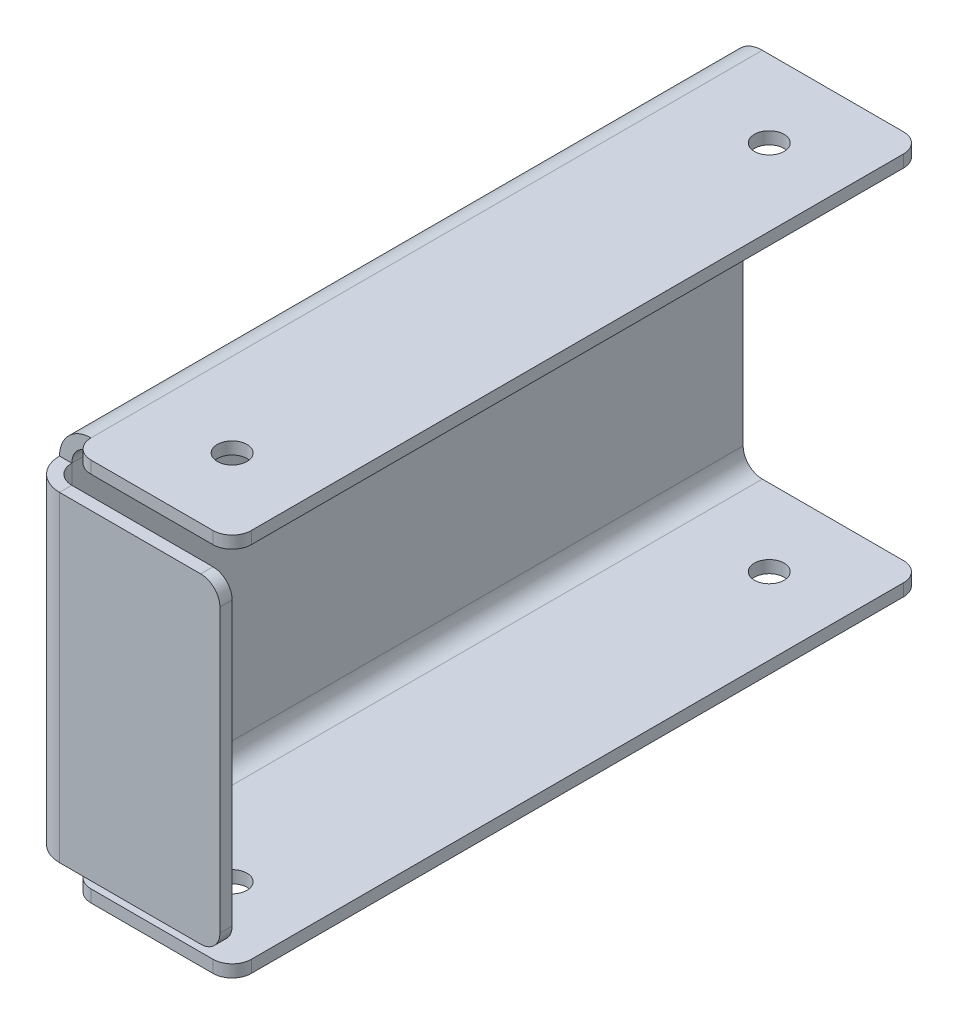
from build123d import *

# Parameters (mm, degrees)
SKETCH1_W                      = 114.3
SKETCH1_H                      = 63.5
BASE_FLANGE1_DEPTH             = 2.032
EDGE_FLANGE1_STRIP_W           = 14.478
EDGE_FLANGE1_STRIP_H           = 2.032
EDGE_FLANGE1_STRIP_CUT_DEPTH   = 114.3
EDGE_FLANGE1_STRIP_2_W         = 14.478
EDGE_FLANGE1_STRIP_2_H         = 2.032
EDGE_FLANGE1_STRIP_CUT_2_DEPTH = 114.3
EDGE_FLANGE1_DEPTH             = 114.3
EDGE_FLANGE1_BEND_DEPTH        = 114.3
EDGE_FLANGE2_DEPTH             = 63.5
EDGE_FLANGE2_2_DEPTH           = 5.207
EDGE_FLANGE2_START             = 58.293
EDGE_FLANGE2_3_DEPTH           = 5.207
EDGE_FLANGE2_START_2           = 5.207
EDGE_FLANGE2_4_DEPTH           = 53.086
SKETCH15_R                     = 2.45745
CUT_EXTRUDE1_DEPTH             = 135.089147674
FILLET1_R                      = 3.175


# Read off the part's stored shape, not the designer's step: Edge-Flange2
# Sheet-metal steps are written as plain solids
with BuildPart() as part:
    # Sketch1 → Base-Flange1 (new body)
    with BuildSketch(Plane(origin=(0, 0, 0), x_dir=(0, 0, -1), z_dir=(1, 0, 0))):
        with Locations((57.15, 31.75)):
            Rectangle(SKETCH1_W, SKETCH1_H)
    extrude(amount=-BASE_FLANGE1_DEPTH)

    # Edge-Flange1 strip (across the edge) → Edge-Flange1 strip cut (cut)
    with BuildSketch(Plane(origin=(0, 63.5, -114.3), x_dir=(0, -1, 0), z_dir=(0, 0, 1))):
        with Locations((-2.032, -1.016)):
            Rectangle(EDGE_FLANGE1_STRIP_W, EDGE_FLANGE1_STRIP_H)
    extrude(amount=EDGE_FLANGE1_STRIP_CUT_DEPTH, mode=Mode.SUBTRACT)

    # Edge-Flange1 strip 2 (across the edge) → Edge-Flange1 strip cut 2 (cut)
    with BuildSketch(Plane.YX):
        with Locations((-2.032, -1.016)):
            Rectangle(EDGE_FLANGE1_STRIP_2_W, EDGE_FLANGE1_STRIP_2_H)
    extrude(amount=EDGE_FLANGE1_STRIP_CUT_2_DEPTH, mode=Mode.SUBTRACT)

    # Edge-Flange1 section (across the edge) → Edge-Flange1 (add)
    with BuildSketch(Plane(origin=(0, 63.5, -114.3), x_dir=(0, -1, 0), z_dir=(0, 0, 1))):
        with BuildLine():
            Line((0, 3.175), (0, 29.718))
            Line((0, 29.718), (2.032, 29.718))
            Line((2.032, 29.718), (2.032, 3.175))
            ThreePointArc((2.032, 3.175), (2.96193597, 0.92993597), (5.207, 0))
            Line((5.207, 0), (5.207, -2.032))
            ThreePointArc((5.207, -2.032), (1.52509499, -0.50690501), (0, 3.175))
        make_face()
    extrude(amount=EDGE_FLANGE1_DEPTH)

    # Edge-Flange1 section 2 (across the edge) → Edge-Flange1 bend (add)
    with BuildSketch(Plane.YX):
        with BuildLine():
            Line((0, 3.175), (0, 29.718))
            Line((0, 29.718), (2.032, 29.718))
            Line((2.032, 29.718), (2.032, 3.175))
            ThreePointArc((2.032, 3.175), (2.96193597, 0.92993597), (5.207, 0))
            Line((5.207, 0), (5.207, -2.032))
            ThreePointArc((5.207, -2.032), (1.52509499, -0.50690501), (0, 3.175))
        make_face()
    extrude(amount=EDGE_FLANGE1_BEND_DEPTH)

    # Edge-Flange2 outline → Edge-Flange2 (cut)
    with BuildSketch(Plane(origin=(0, 0, 0), x_dir=(1, 0, 0), z_dir=(0, 1, 0))):
        with BuildLine():
            Line((3.175, 0), (3.175, 3.175))
            Line((3.175, 3.175), (0, 3.175))
            ThreePointArc((0, 3.175), (0.92993597, 0.92993597), (3.175, 0))
        make_face()
        with BuildLine():
            ThreePointArc((-0.95201151, 0), (-1.754614485, 1.498172628), (-2.032, 3.175))
            Line((-2.032, 3.175), (-2.032, 0))
            Line((-2.032, 0), (-0.95201151, 0))
        make_face()
    extrude(amount=EDGE_FLANGE2_DEPTH, mode=Mode.SUBTRACT)

    # Edge-Flange2 2 outline → Edge-Flange2 2 (cut)
    with BuildSketch(Plane(origin=(0, 0, 0), x_dir=(1, 0, 0), z_dir=(0, 1, 0))):
        with BuildLine():
            ThreePointArc((3.175, 0), (0.92993597, 0.92993597), (0, 3.175))
            Line((0, 3.175), (-2.032, 3.175))
            ThreePointArc((-2.032, 3.175), (-1.754614485, 1.498172628), (-0.95201151, 0))
            Line((-0.95201151, 0), (3.175, 0))
        make_face()
    extrude(amount=EDGE_FLANGE2_2_DEPTH, mode=Mode.SUBTRACT)

    # Edge-Flange2 3 outline → Edge-Flange2 3 (cut)
    with BuildSketch(Plane(origin=(0, 0, 0), x_dir=(1, 0, 0), z_dir=(0, 1, 0)).offset(EDGE_FLANGE2_START)):
        with BuildLine():
            ThreePointArc((3.175, 0), (0.92993597, 0.92993597), (0, 3.175))
            Line((0, 3.175), (-2.032, 3.175))
            ThreePointArc((-2.032, 3.175), (-1.754614485, 1.498172628), (-0.95201151, 0))
            Line((-0.95201151, 0), (3.175, 0))
        make_face()
    extrude(amount=EDGE_FLANGE2_3_DEPTH, mode=Mode.SUBTRACT)

    # Edge-Flange2 4 outline → Edge-Flange2 4 (add)
    with BuildSketch(Plane(origin=(0, 0, 0), x_dir=(1, 0, 0), z_dir=(0, 1, 0)).offset(EDGE_FLANGE2_START_2)):
        with BuildLine():
            Line((0, 3.175), (0, 0))
            Line((0, 0), (-0.95201151, 0))
            ThreePointArc((-0.95201151, 0), (0.874932175, -1.496459836), (3.175, -2.032))
            Line((3.175, -2.032), (29.718, -2.032))
            Line((29.718, -2.032), (29.718, 0))
            Line((29.718, 0), (3.175, 0))
            ThreePointArc((3.175, 0), (0.92993597, 0.92993597), (0, 3.175))
        make_face()
    extrude(amount=EDGE_FLANGE2_4_DEPTH)

    # Sketch15 → Cut-Extrude1 (cut, through all)
    with BuildSketch(Plane(origin=(0, 63.5, 0), x_dir=(1, 0, 0), z_dir=(0, 1, 0))):
        with Locations(Location((17.018, 101.6, 0), (0, 0, 180))):
            Circle(SKETCH15_R)
        with Locations(Location((17.018, 12.7, 0), (0, 0, 180))):
            Circle(SKETCH15_R)
    extrude(amount=-CUT_EXTRUDE1_DEPTH, mode=Mode.SUBTRACT)

    # Fillet1
    fillet1_edges = [part.edges().sort_by_distance(p)[0] for p in [
        (29.718, 1.016, -114.3),
        (29.718, 62.484, -114.3),
        (3.175, 1.016, 0),
        (29.718, 1.016, 0),
        (29.718, 5.207, 1.016),
        (29.718, 58.293, 1.016),
        (29.718, 62.484, 0),
        (3.175, 62.484, 0),
    ]]
    fillet(fillet1_edges, radius=FILLET1_R - 0.0001)  # a hair under: the kernel refuses the full size


solid = part.part
